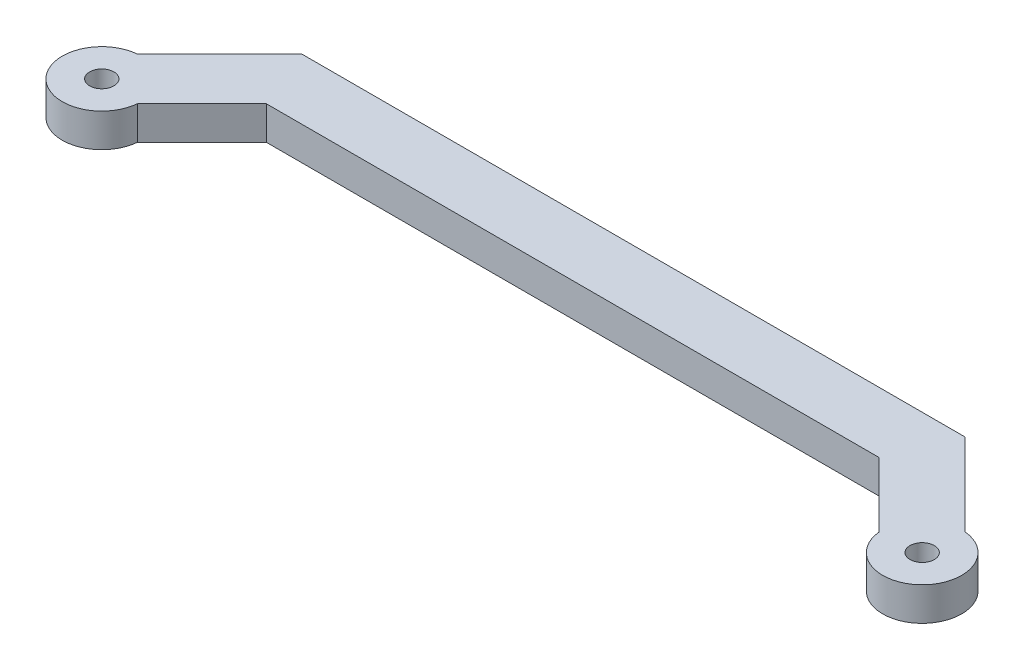
from build123d import *

# Parameters (mm, degrees)
SKETCH1_R           = 2
BOSS_EXTRUDE1_DEPTH = 5.5


with BuildPart() as part:
    # Sketch1 → Boss-Extrude1 (new body)
    with BuildSketch(Plane(origin=(0, 0, 0), x_dir=(1, 0, 0), z_dir=(0, 1, 0))):
        with BuildLine():
            Line((-50.428932188, 0), (50.428932188, 0))
            Line((50.428932188, 0), (61.027631063, -10.598698875))
            ThreePointArc((61.027631063, -10.598698875), (72.096194078, -14.596194078), (68.098698875, -3.527631063))
            Line((68.098698875, -3.527631063), (54.571067812, 10))
            Line((54.571067812, 10), (-54.571067812, 10))
            Line((-54.571067812, 10), (-68.098698875, -3.527631063))
            ThreePointArc((-68.098698875, -3.527631063), (-72.096194078, -14.596194078), (-61.027631063, -10.598698875))
            Line((-61.027631063, -10.598698875), (-50.428932188, 0))
        make_face()
        with Locations((67.5, -10)):
            Circle(SKETCH1_R, mode=Mode.SUBTRACT)
        with Locations((-67.5, -10)):
            Circle(SKETCH1_R, mode=Mode.SUBTRACT)
    extrude(amount=BOSS_EXTRUDE1_DEPTH)


solid = part.part
